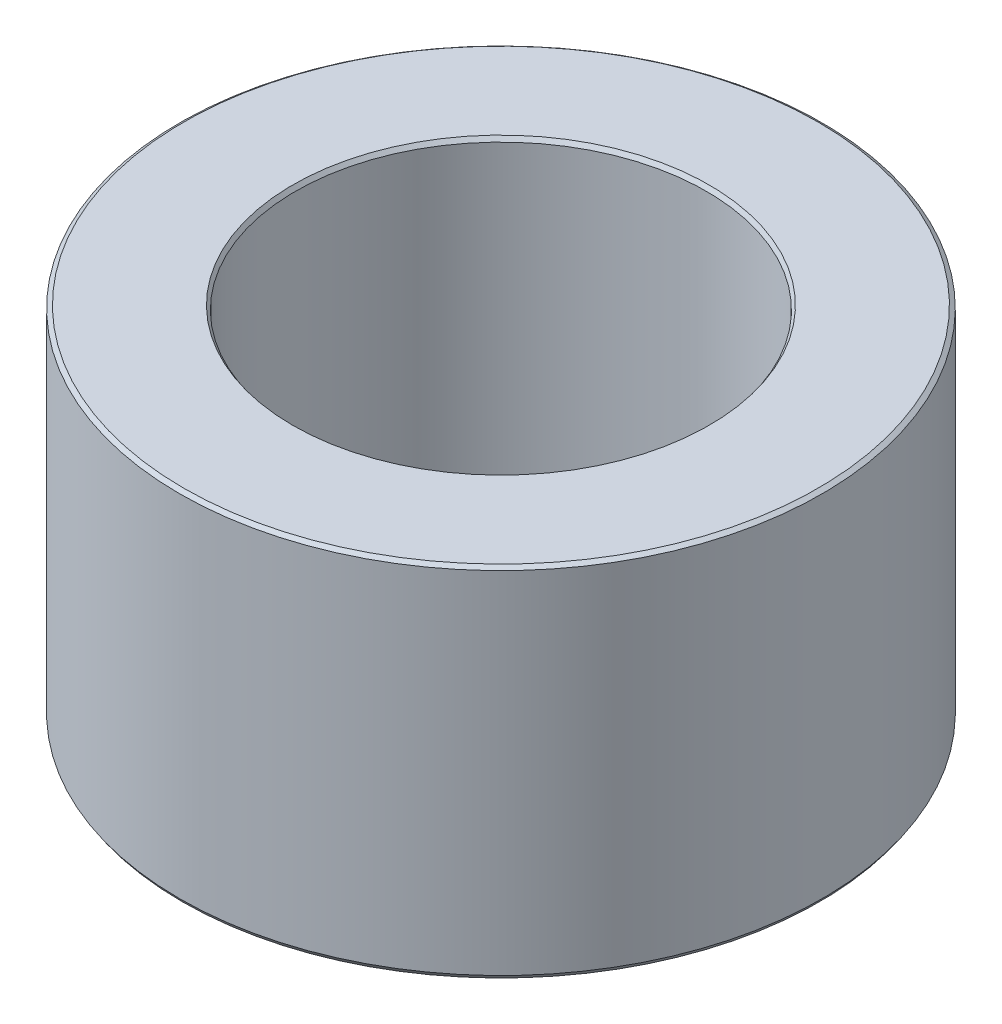
from build123d import *
from OCP.BRepFilletAPI import BRepFilletAPI_MakeChamfer

# Parameters (mm, degrees)
SKETCH1_R           = 42.5
BOSS_EXTRUDE1_DEPTH = 47.296056195
SKETCH2_R           = 27.181760625
CUT_EXTRUDE1_DEPTH  = 77.481480971
CHAMFER1_SIZE       = 0.365105276
CHAMFER1_SIZE2      = 0.544720812


with BuildPart() as part:
    # Sketch1 → Boss-Extrude1 (new body)
    with BuildSketch(Plane(origin=(0, 0, 0), x_dir=(1, 0, 0), z_dir=(0, 1, 0))):
        Circle(SKETCH1_R)
    extrude(amount=BOSS_EXTRUDE1_DEPTH)

    # Sketch2 → Cut-Extrude1 (cut, through all)
    with BuildSketch(Plane(origin=(0, 0, 0), x_dir=(1, 0, 0), z_dir=(0, 1, 0))):
        Circle(SKETCH2_R)
    extrude(amount=CUT_EXTRUDE1_DEPTH, mode=Mode.SUBTRACT)

    # Chamfer1: one chamfer whose edges measure the first distance from different faces: ONE call of the kernel's chamfer builder (chamfer() names one face for all edges)
    chamfer1_edges_1 = [part.edges().sort_by_distance(p)[0] for p in [
        (-27.181760625, 47.296056195, 0),
    ]]
    chamfer1_side_1 = [part.faces().sort_by_distance(p)[0] for p in [
        (-41.297918472, 47.296056195, 0),
    ]]
    chamfer1_edges_2 = [part.edges().sort_by_distance(p)[0] for p in [
        (-27.181760625, 0, 0),
    ]]
    chamfer1_side_2 = [part.faces().sort_by_distance(p)[0] for p in [
        (-27.181760625, 23.648028097, 0),
    ]]
    chamfer1_edges_3 = [part.edges().sort_by_distance(p)[0] for p in [
        (-42.5, 0, 0),
    ]]
    chamfer1_side_3 = [part.faces().sort_by_distance(p)[0] for p in [
        (-41.297918472, 0, 0),
    ]]
    chamfer1_edges_4 = [part.edges().sort_by_distance(p)[0] for p in [
        (-42.5, 47.296056195, 0),
    ]]
    chamfer1_side_4 = [part.faces().sort_by_distance(p)[0] for p in [
        (-42.5, 23.648028097, 0),
    ]]
    chamfer1 = BRepFilletAPI_MakeChamfer(part.part.solid().wrapped)
    for e in chamfer1_edges_1:
        chamfer1.Add(CHAMFER1_SIZE, CHAMFER1_SIZE2, e.wrapped, chamfer1_side_1[0].wrapped)  # the first distance lies on this face
    for e in chamfer1_edges_2:
        chamfer1.Add(CHAMFER1_SIZE, CHAMFER1_SIZE2, e.wrapped, chamfer1_side_2[0].wrapped)  # the first distance lies on this face
    for e in chamfer1_edges_3:
        chamfer1.Add(CHAMFER1_SIZE, CHAMFER1_SIZE2, e.wrapped, chamfer1_side_3[0].wrapped)  # the first distance lies on this face
    for e in chamfer1_edges_4:
        chamfer1.Add(CHAMFER1_SIZE, CHAMFER1_SIZE2, e.wrapped, chamfer1_side_4[0].wrapped)  # the first distance lies on this face
    add(Compound.cast(chamfer1.Shape()), mode=Mode.REPLACE)


solid = part.part
